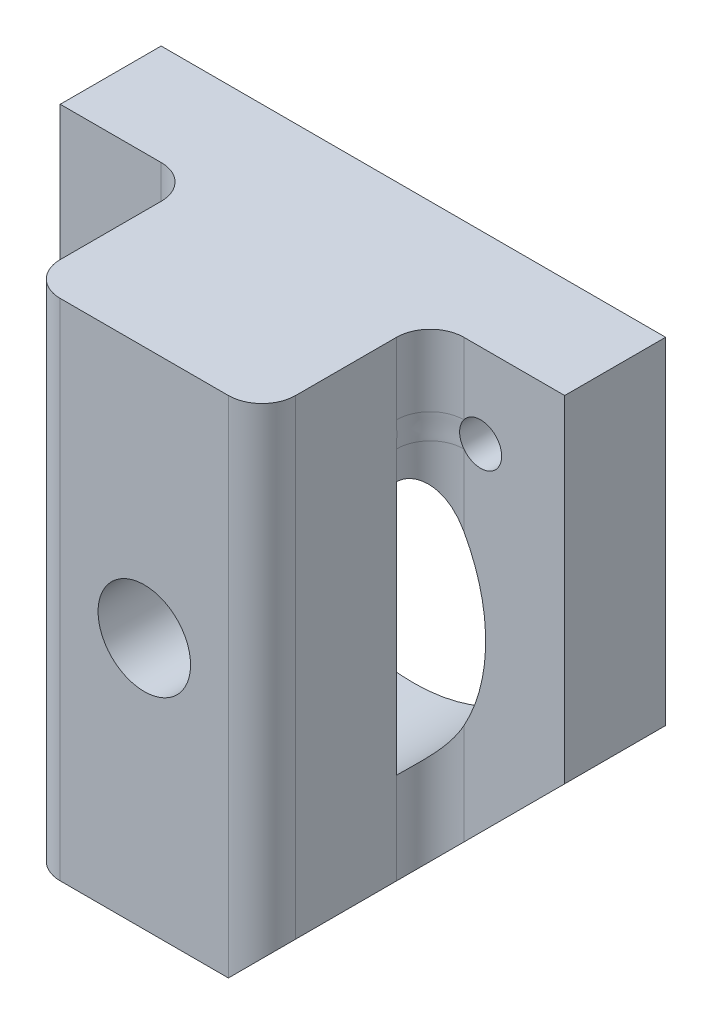
from build123d import *

# Parameters (mm, degrees)
SKETCH1_R          = 1.25
MAIN_DEPTH         = 16
SKETCH2_R          = 10.3
CENTRALHOLE_DEPTH  = 8
SKETCH5_R          = 2.75
SKETCH5_W          = 8
SKETCH5_H          = 30
CUT_EXTRUDE3_DEPTH = 10
FILLET1_R          = 2


with BuildPart() as part:
    # Sketch1 → Main (new body)
    with BuildSketch(Plane.XY):
        Polygon((-15, -15), (5, -15), (15, -5), (15, 15), (-15, 15), align=None)
        with Locations((-10, 10)):
            Circle(SKETCH1_R, mode=Mode.SUBTRACT)
        with Locations((10, 10)):
            Circle(SKETCH1_R, mode=Mode.SUBTRACT)
        with Locations((-10, -10)):
            Circle(SKETCH1_R, mode=Mode.SUBTRACT)
    extrude(amount=MAIN_DEPTH)

    # Sketch2 → CentralHole (cut)
    with BuildSketch(Plane.XY):
        Circle(SKETCH2_R)
    extrude(amount=CENTRALHOLE_DEPTH, mode=Mode.SUBTRACT)

    # Sketch5 → Cut-Extrude3 (cut)
    with BuildSketch(Plane.XY.offset(16)):
        Circle(SKETCH5_R)
        with Locations((11, 0)):
            Rectangle(SKETCH5_W, SKETCH5_H)
        with Locations((-11, 0)):
            Rectangle(SKETCH5_W, SKETCH5_H)
    extrude(amount=-CUT_EXTRUDE3_DEPTH, mode=Mode.SUBTRACT)

    # Fillet1
    fillet1_edges = [part.edges().sort_by_distance(p)[0] for p in [
        (-7, 0, 16),
        (7, 1, 16),
        (-7, -11.27789624, 6),
        (-7, 11.27789624, 6),
        (7, 11.27789624, 6),
        (7, -10.27789624, 6),
    ]]
    fillet(fillet1_edges, radius=FILLET1_R)


solid = part.part
